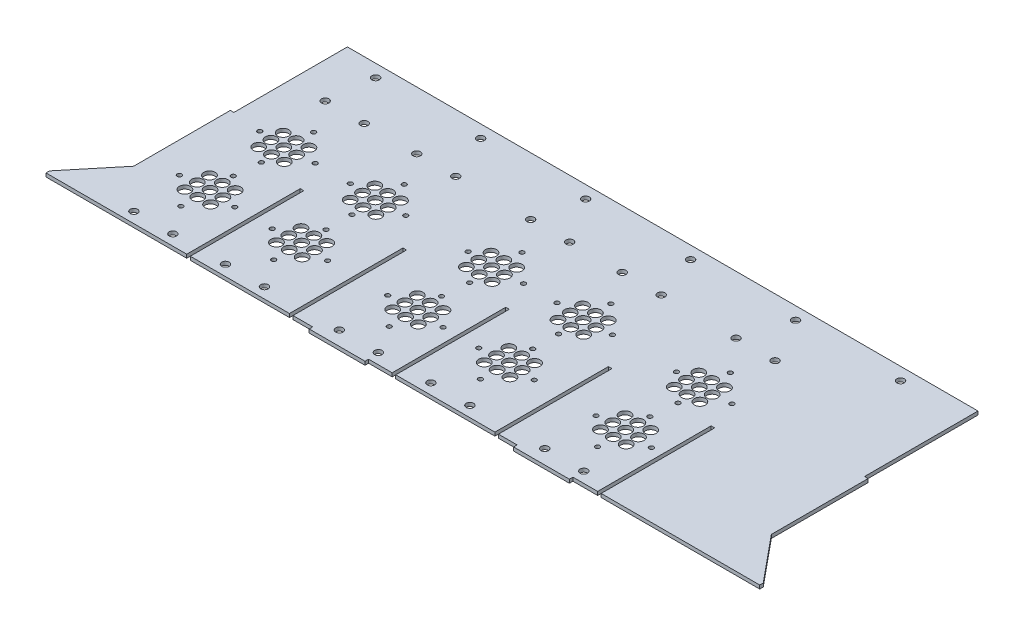
from build123d import *

# Parameters (mm, degrees)
SKETCH1_W            = 570.861
SKETCH1_H            = 3.175
BOSS_EXTRUDE1_DEPTH  = 232.6
SKETCH7_R            = 3.302
CUT_EXTRUDE4_DEPTH   = 369.216527271
SKETCH6_W            = 50
SKETCH6_H            = 3.175
BOSS_EXTRUDE2_DEPTH  = 3.175
LPATTERN1_COUNT      = 6
LPATTERN1_PITCH      = 93.98
SKETCH2_W            = 3.175
SKETCH2_H            = 101.6
CUT_EXTRUDE5_DEPTH   = 371.230335845
BOSS_EXTRUDE3_DEPTH  = 3.175
SKETCH13_W           = 3.175
SKETCH13_H           = 101.6
CUT_EXTRUDE6_DEPTH   = 398.062685067
LPATTERN2_COUNT      = 5
LPATTERN2_PITCH      = 91.9550104
M6_CLEARANCE_HOLE1_D = 6.6
M6_CLEARANCE_HOLE2_D = 6.6
LPATTERN3_COUNT      = 3
LPATTERN3_PITCH      = 183.919999952
LPATTERN4_COUNT      = 2
LPATTERN4_PITCH      = 183.919999952
SKETCH20_R           = 2
CUT_EXTRUDE8_DEPTH   = 398.16416411
SKETCH21_R           = 5
CUT_EXTRUDE9_DEPTH   = 398.062685067
LPATTERN5_COUNT      = 3
LPATTERN5_PITCH      = 186
SKETCH22_R           = 5
CUT_EXTRUDE10_DEPTH  = 398.062685067
LPATTERN6_COUNT      = 2
LPATTERN6_PITCH      = 186


with BuildPart() as part:
    # Sketch1 → Boss-Extrude1 (new body)
    with BuildSketch(Plane.XY):
        Rectangle(SKETCH1_W, SKETCH1_H)
    extrude(amount=BOSS_EXTRUDE1_DEPTH)

    # Sketch7 → Cut-Extrude4 (cut, through all)
    with BuildSketch(Plane(origin=(0, -1.5875, 0), x_dir=(-1, 0, 0), z_dir=(0, -1, 0))):
        with Locations((-224.2195, -11.29165)):
            Circle(SKETCH7_R)
    cut_extrude4 = extrude(amount=-CUT_EXTRUDE4_DEPTH, mode=Mode.SUBTRACT)

    # Sketch6 → Boss-Extrude2 (add)
    with BuildSketch(Plane.XY.offset(232.6)):
        with Locations((127.26300405, 0)):
            Rectangle(SKETCH6_W, SKETCH6_H)
        with Locations((-55.6950692, 0)):
            Rectangle(SKETCH6_W, SKETCH6_H)
    extrude(amount=BOSS_EXTRUDE2_DEPTH)

    # LPattern1: Cut-Extrude4 ×6
    with Locations(*[(-i * LPATTERN1_PITCH, 0, 0) for i in range(1, LPATTERN1_COUNT)]):
        add(cut_extrude4, mode=Mode.SUBTRACT)

    # Sketch2 → Cut-Extrude5 (cut, through all)
    with BuildSketch(Plane(origin=(0, 1.5875, 0), x_dir=(1, 0, 0), z_dir=(0, 1, 0))):
        with Locations((283.843, -50.8)):
            Rectangle(SKETCH2_W, SKETCH2_H)
        with Locations((-283.843, -50.8)):
            Rectangle(SKETCH2_W, SKETCH2_H)
    extrude(amount=-CUT_EXTRUDE5_DEPTH, mode=Mode.SUBTRACT)

    # Sketch12 → Boss-Extrude3 (add)
    with BuildSketch(Plane(origin=(0, 1.5875, 0), x_dir=(1, 0, 0), z_dir=(0, 1, 0))):
        Polygon((-319.4665, -232.6), (-285.4305, -232.6), (-285.4305, -188.15), (-319.4665, -229.425), align=None)
    boss_extrude3 = extrude(amount=-BOSS_EXTRUDE3_DEPTH)

    # Mirror1: Boss-Extrude3 across plane
    add(boss_extrude3.mirror(Plane(origin=(0, 0, 0), x_dir=(0, 0, 1), z_dir=(1, 0, 0))))

    # Sketch13 → Cut-Extrude6 (cut, through all)
    with BuildSketch(Plane.XZ.offset(1.5875)):
        with Locations((-191.8879896, 181.8)):
            Rectangle(SKETCH13_W, SKETCH13_H)
    cut_extrude6 = extrude(amount=-CUT_EXTRUDE6_DEPTH, mode=Mode.SUBTRACT)

    # LPattern2: Cut-Extrude6 ×5
    with Locations(*[(i * LPATTERN2_PITCH, 0, 0) for i in range(1, LPATTERN2_COUNT)]):
        add(cut_extrude6, mode=Mode.SUBTRACT)

    # M6 Clearance Hole1 (through all)
    with Locations(Plane(origin=(0, 1.5875, 0), x_dir=(1, 0, 0), z_dir=(0, 1, 0))):
        with Locations((-250.327997081, -223.075), (-215.402997081, -223.075), (-215.402997081, -51.825), (-250.327997081, -51.825)):
            m6_clearance_hole1 = Hole(M6_CLEARANCE_HOLE1_D / 2)

    # M6 Clearance Hole2 (through all)
    with Locations(Plane(origin=(0, 1.5875, 0), x_dir=(1, 0, 0), z_dir=(0, 1, 0))):
        with Locations((-168.370494162, -223.075), (-133.445494162, -223.075), (-168.370494162, -51.825), (-133.445494162, -51.825)):
            m6_clearance_hole2 = Hole(M6_CLEARANCE_HOLE2_D / 2)

    # LPattern3: M6 Clearance Hole1 ×3
    with Locations(*[(i * LPATTERN3_PITCH, 0, 0) for i in range(1, LPATTERN3_COUNT)]):
        add(m6_clearance_hole1, mode=Mode.SUBTRACT)

    # LPattern4: M6 Clearance Hole2 ×2
    with Locations(*[(i * LPATTERN4_PITCH, 0, 0) for i in range(1, LPATTERN4_COUNT)]):
        add(m6_clearance_hole2, mode=Mode.SUBTRACT)

    # Sketch20 → Cut-Extrude8 (cut, through all)
    with BuildSketch(Plane(origin=(0, 7.935000001, 0), x_dir=(1, 0, 0), z_dir=(0, 1, 0))):
        with Locations((-206.464860636, -104.637084158)):
            Circle(SKETCH20_R)
        with Locations((-231.250394541, -128.058151968)):
            Circle(SKETCH20_R)
        with Locations((-256.035928446, -104.637084158)):
            Circle(SKETCH20_R)
        with Locations((-231.250394541, -81.216016348)):
            Circle(SKETCH20_R)
        with Locations((-174.982578446, -174.6221)):
            Circle(SKETCH20_R)
        with Locations((-150.197044541, -198.04316781)):
            Circle(SKETCH20_R)
        with Locations((-150.197044541, -151.20103219)):
            Circle(SKETCH20_R)
        with Locations((-125.411510636, -174.6221)):
            Circle(SKETCH20_R)
        with Locations((-21.999097153, -174.6221)):
            Circle(SKETCH20_R)
        with Locations((-46.784631058, -198.04316781)):
            Circle(SKETCH20_R)
        with Locations((-46.784631058, -151.20103219)):
            Circle(SKETCH20_R)
        with Locations((-71.570164963, -174.6221)):
            Circle(SKETCH20_R)
        with Locations((-125.411510636, -104.637084158)):
            Circle(SKETCH20_R)
        with Locations((-150.197044541, -128.058151968)):
            Circle(SKETCH20_R)
        with Locations((-174.982578446, -104.637084158)):
            Circle(SKETCH20_R)
        with Locations((-150.197044541, -81.216016348)):
            Circle(SKETCH20_R)
        with Locations((-208.499097153, -174.6221)):
            Circle(SKETCH20_R)
        with Locations((-233.284631058, -198.04316781)):
            Circle(SKETCH20_R)
        with Locations((-258.070164963, -174.6221)):
            Circle(SKETCH20_R)
        with Locations((-233.284631058, -151.20103219)):
            Circle(SKETCH20_R)
        with Locations((-44.750394541, -128.058151968)):
            Circle(SKETCH20_R)
        with Locations((-19.964860636, -104.637084158)):
            Circle(SKETCH20_R)
        with Locations((-44.750394541, -81.216016348)):
            Circle(SKETCH20_R)
        with Locations((-69.535928446, -104.637084158)):
            Circle(SKETCH20_R)
        with Locations((34.802955459, -198.04316781)):
            Circle(SKETCH20_R)
        with Locations((59.588489364, -174.6221)):
            Circle(SKETCH20_R)
        with Locations((34.802955459, -151.20103219)):
            Circle(SKETCH20_R)
        with Locations((10.017421554, -174.6221)):
            Circle(SKETCH20_R)
        with Locations((34.802955459, -128.058151968)):
            Circle(SKETCH20_R)
        with Locations((10.017421554, -104.637084158)):
            Circle(SKETCH20_R)
        with Locations((59.588489364, -104.637084158)):
            Circle(SKETCH20_R)
        with Locations((34.802955459, -81.216016348)):
            Circle(SKETCH20_R)
        with Locations((139.715368942, -198.04316781)):
            Circle(SKETCH20_R)
        with Locations((114.929835037, -174.6221)):
            Circle(SKETCH20_R)
        with Locations((164.500902847, -174.6221)):
            Circle(SKETCH20_R)
        with Locations((139.715368942, -151.20103219)):
            Circle(SKETCH20_R)
        with Locations((166.535139364, -104.637084158)):
            Circle(SKETCH20_R)
        with Locations((141.749605459, -128.058151968)):
            Circle(SKETCH20_R)
        with Locations((116.964071554, -104.637084158)):
            Circle(SKETCH20_R)
        with Locations((141.749605459, -81.216016348)):
            Circle(SKETCH20_R)
    extrude(amount=-CUT_EXTRUDE8_DEPTH, mode=Mode.SUBTRACT)

    # Sketch21 → Cut-Extrude9 (cut, through all)
    with BuildSketch(Plane(origin=(0, 1.5875, 0), x_dir=(1, 0, 0), z_dir=(0, 1, 0))):
        with Locations((-232.865497081, -95.343337061)):
            Circle(SKETCH21_R)
        with Locations((-244.365497081, -95.343337061)):
            Circle(SKETCH21_R)
        with Locations((-244.365497081, -106.343337061)):
            Circle(SKETCH21_R)
        with Locations((-244.365497081, -117.343337061)):
            Circle(SKETCH21_R)
        with Locations((-221.365497081, -106.343337061)):
            Circle(SKETCH21_R)
        with Locations((-232.865497081, -106.343337061)):
            Circle(SKETCH21_R)
        with Locations((-232.865497081, -117.343337061)):
            Circle(SKETCH21_R)
        with Locations((-221.365497081, -117.343337061)):
            Circle(SKETCH21_R)
        with Locations((-221.365497081, -95.343337061)):
            Circle(SKETCH21_R)
        with Locations((-244.365497081, -183.343337061)):
            Circle(SKETCH21_R)
        with Locations((-232.865497081, -183.343337061)):
            Circle(SKETCH21_R)
        with Locations((-221.365497081, -183.343337061)):
            Circle(SKETCH21_R)
        with Locations((-221.365497081, -172.343337061)):
            Circle(SKETCH21_R)
        with Locations((-221.365497081, -161.343337061)):
            Circle(SKETCH21_R)
        with Locations((-232.865497081, -161.343337061)):
            Circle(SKETCH21_R)
        with Locations((-232.865497081, -172.343337061)):
            Circle(SKETCH21_R)
        with Locations((-244.365497081, -172.343337061)):
            Circle(SKETCH21_R)
        with Locations((-244.365497081, -161.343337061)):
            Circle(SKETCH21_R)
    cut_extrude9 = extrude(amount=-CUT_EXTRUDE9_DEPTH, mode=Mode.SUBTRACT)

    # LPattern5: Cut-Extrude9 ×3
    with Locations(*[(i * LPATTERN5_PITCH, 0, 0) for i in range(1, LPATTERN5_COUNT)]):
        add(cut_extrude9, mode=Mode.SUBTRACT)

    # Sketch22 → Cut-Extrude10 (cut, through all)
    with BuildSketch(Plane(origin=(0, 1.5875, 0), x_dir=(1, 0, 0), z_dir=(0, 1, 0))):
        with Locations((-139.407994162, -117.343337061)):
            Circle(SKETCH22_R)
        with Locations((-150.907994162, -117.343337061)):
            Circle(SKETCH22_R)
        with Locations((-162.407994162, -117.343337061)):
            Circle(SKETCH22_R)
        with Locations((-162.407994162, -106.343337061)):
            Circle(SKETCH22_R)
        with Locations((-150.907994162, -106.343337061)):
            Circle(SKETCH22_R)
        with Locations((-139.407994162, -106.343337061)):
            Circle(SKETCH22_R)
        with Locations((-139.407994162, -95.343337061)):
            Circle(SKETCH22_R)
        with Locations((-150.907994162, -95.343337061)):
            Circle(SKETCH22_R)
        with Locations((-162.407994162, -95.343337061)):
            Circle(SKETCH22_R)
        with Locations((-139.407994162, -183.343337061)):
            Circle(SKETCH22_R)
        with Locations((-139.407994162, -172.343337061)):
            Circle(SKETCH22_R)
        with Locations((-139.407994162, -161.343337061)):
            Circle(SKETCH22_R)
        with Locations((-150.907994162, -161.343337061)):
            Circle(SKETCH22_R)
        with Locations((-150.907994162, -172.343337061)):
            Circle(SKETCH22_R)
        with Locations((-150.907994162, -183.343337061)):
            Circle(SKETCH22_R)
        with Locations((-162.407994162, -183.343337061)):
            Circle(SKETCH22_R)
        with Locations((-162.407994162, -172.343337061)):
            Circle(SKETCH22_R)
        with Locations((-162.407994162, -161.343337061)):
            Circle(SKETCH22_R)
    cut_extrude10 = extrude(amount=-CUT_EXTRUDE10_DEPTH, mode=Mode.SUBTRACT)

    # LPattern6: Cut-Extrude10 ×2
    with Locations(*[(i * LPATTERN6_PITCH, 0, 0) for i in range(1, LPATTERN6_COUNT)]):
        add(cut_extrude10, mode=Mode.SUBTRACT)


solid = part.part
